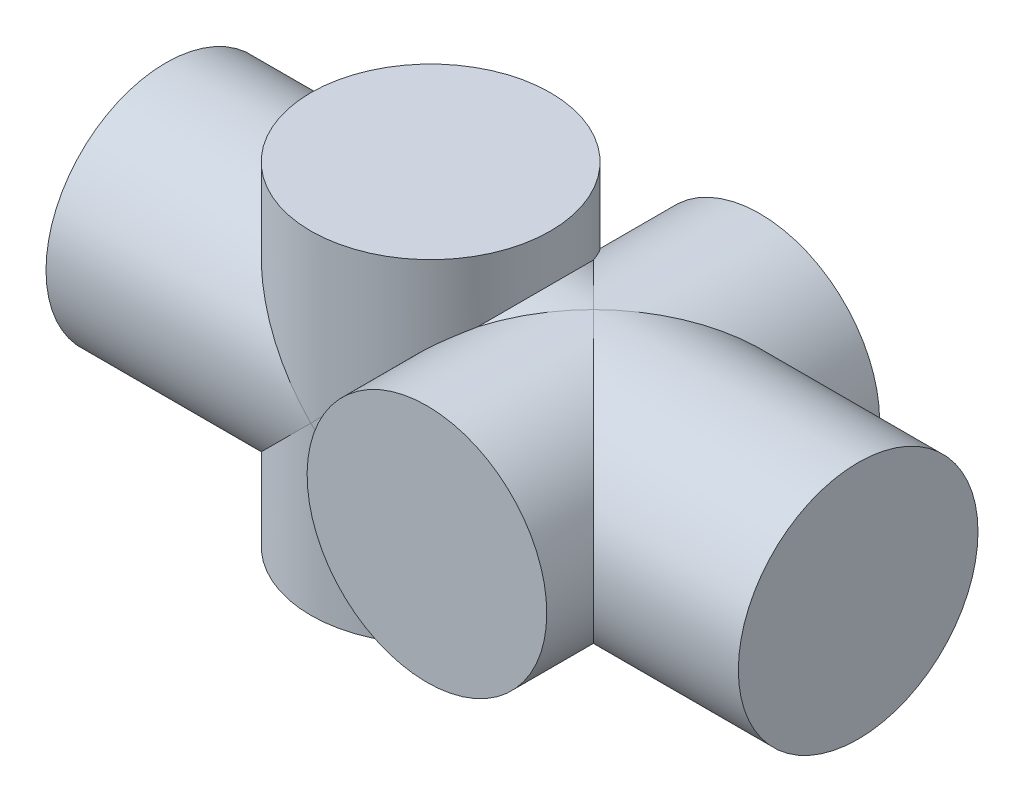
from build123d import *

# Parameters (mm, degrees)
CROQUIS2_R              = 81
SALIENTE_EXTRUIR1_DEPTH = 112.5
CROQUIS3_R              = 81
SALIENTE_EXTRUIR2_DEPTH = 112.5
CROQUIS3D7_R            = 81
SALIENTE_EXTRUIR3_DEPTH = 468


with BuildPart() as part:
    # Croquis2 → Saliente-Extruir1 (new, symmetric)
    with BuildSketch(Plane(origin=(0, 0, 0), x_dir=(1, 0, 0), z_dir=(0, 1, 0))):
        with Locations((-131.5, 0)):
            Circle(CROQUIS2_R)
    extrude(amount=SALIENTE_EXTRUIR1_DEPTH, both=True)

    # Croquis3 → Saliente-Extruir2 (add, symmetric)
    with BuildSketch(Plane.XY):
        with Locations((-21.5, 0)):
            Circle(CROQUIS3_R)
    extrude(amount=SALIENTE_EXTRUIR2_DEPTH, both=True)

    # Croquis3D7 → Saliente-Extruir3 (add)
    with BuildSketch(Plane(origin=(157.5, 0, 0), x_dir=(0, 0, 1), z_dir=(1, 0, 0))):
        Circle(CROQUIS3D7_R)
    extrude(amount=-SALIENTE_EXTRUIR3_DEPTH)


solid = part.part
